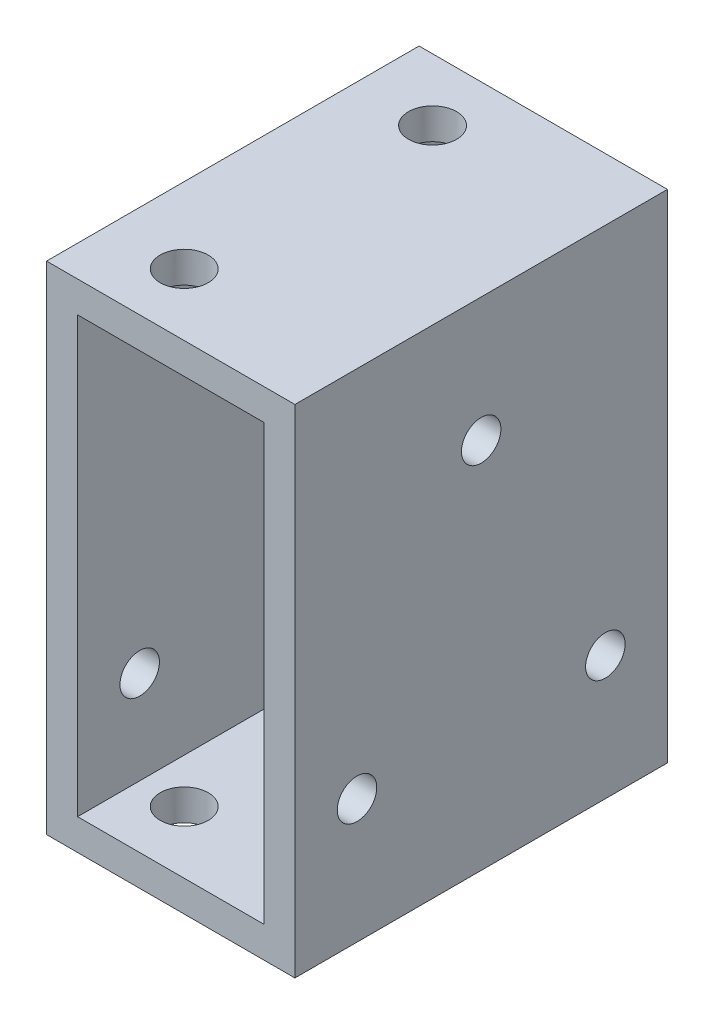
from build123d import *

# Parameters (mm, degrees)
SKETCH1_W                    = 25.4
SKETCH1_H                    = 50.8
SKETCH1_W_2                  = 19.05
SKETCH1_H_2                  = 44.45
BOSS_EXTRUDE1_DEPTH          = 19.05
F_10_0_1935_DIAMETER_HOLE1_D = 4.9149
F_10_32_TAPPED_HOLE1_D       = 4.0386


with BuildPart() as part:
    # Sketch1 → Boss-Extrude1 (new, symmetric)
    with BuildSketch(Plane.XY):
        Rectangle(SKETCH1_W, SKETCH1_H)
        Rectangle(SKETCH1_W_2, SKETCH1_H_2, mode=Mode.SUBTRACT)
    extrude(amount=BOSS_EXTRUDE1_DEPTH, both=True)

    # #10 (0.1935) Diameter Hole1 (through all)
    with Locations(Plane(origin=(0, 25.4, 0), x_dir=(1, 0, 0), z_dir=(0, 1, 0))):
        with Locations((-4.971199017, -12.7), (-4.971199017, 12.7)):
            Hole(F_10_0_1935_DIAMETER_HOLE1_D / 2)

    # #10-32 Tapped Hole1 (through all)
    with Locations(Plane.ZY.offset(12.7)):
        with Locations((-12.7, -12.7), (12.7, -12.7), (0, 12.7)):
            Hole(F_10_32_TAPPED_HOLE1_D / 2)


solid = part.part
